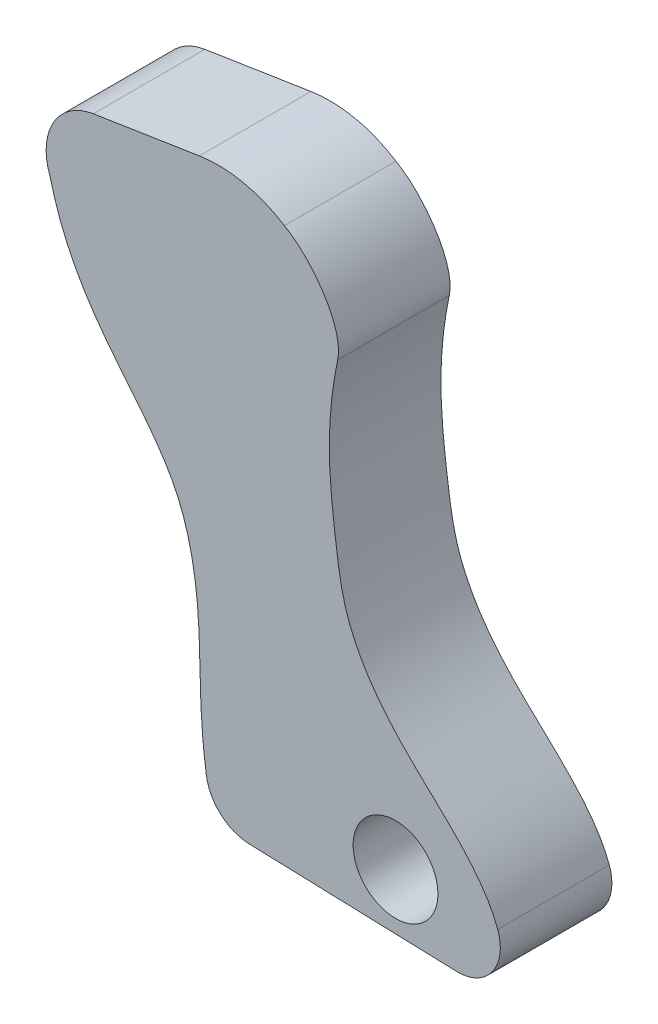
from build123d import *

# Parameters (mm, degrees)
BOSS_EXTRUDE1_DEPTH         = 2.54
F_48_0_076_DIAMETER_HOLE1_D = 1.9304


with BuildPart() as part:
    # Sketch1 → Boss-Extrude1 (new body)
    with BuildSketch(Plane.XY):
        with BuildLine():
            Line((-1.523739013, -6.254008737), (3.199990263, -6.407247691))
            ThreePointArc((3.199990263, -6.407247691), (4.013460409, -6.008075165), (4.137562895, -5.110483411))
            add(Edge.make_bspline(
                [(4.137562895, -5.110483411), (3.751708737, -4.057424722), (1.960352922, -2.838406427), (0.682892057, -0.893226264), (0.419560202, 0.841832203), (0.235366214, 2.465138109), (0.366891085, 3.681965276), (0.493851252, 4.296654744)],
                knots=[0, 0, 0, 0, 0.339614963, 0.543785507, 0.644514611, 0.831601299, 1, 1, 1, 1], degree=3))
            add(Edge.make_bspline(
                [(-0.718288865, 6.33558287), (-0.121151201, 6.007229545), (0.640025429, 5.004370625), (0.493851252, 4.296654744)],
                knots=[0, 0, 0, 0, 1, 1, 1, 1], degree=3))
            ThreePointArc((-0.718288865, 6.33558287), (-1.649329968, 6.716784948), (-2.655033, 6.743505128))
            Line((-2.655033, 6.743505128), (-5.069160306, 6.367615902))
            ThreePointArc((-5.069160306, 6.367615902), (-5.974847558, 5.745610239), (-6.05644367, 4.64993578))
            add(Edge.make_bspline(
                [(-6.05644367, 4.64993578), (-5.472575235, 2.247634521), (-3.140324972, 0.9129092), (-2.564431384, -2.647350002), (-2.677357403, -4.146707908), (-2.496094371, -5.385625532)],
                knots=[0, 0, 0, 0, 0.493395358, 0.716015145, 1, 1, 1, 1], degree=3))
            ThreePointArc((-2.496094371, -5.385625532), (-2.167559601, -5.996334743), (-1.523739013, -6.254008737))
        make_face()
    extrude(amount=BOSS_EXTRUDE1_DEPTH)

    # #48 (0.076) Diameter Hole1 (through all)
    with Locations(Plane.XY.offset(2.54)):
        with Locations((1.811202951, -5.091527006)):
            Hole(F_48_0_076_DIAMETER_HOLE1_D / 2)


solid = part.part
